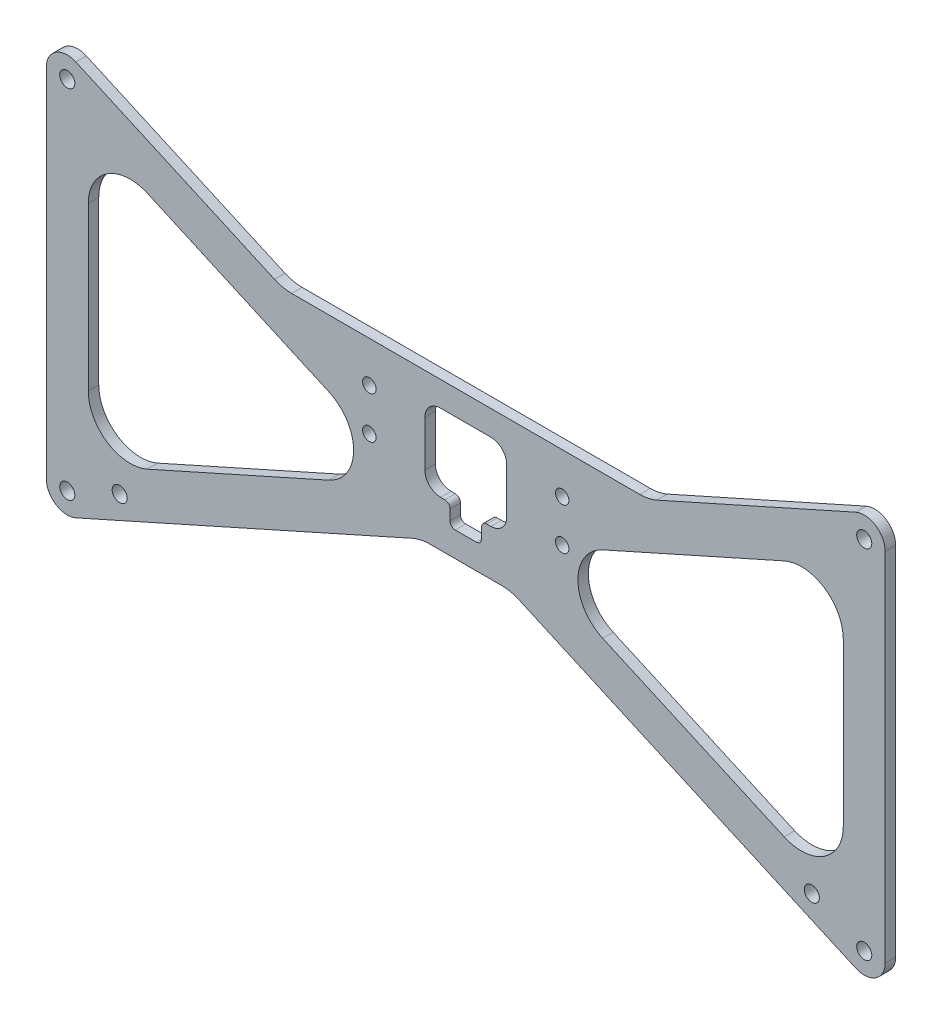
from build123d import *

# Parameters (mm, degrees)
BOSS_EXTRUDE1_DEPTH = 3.175
SKETCH2_R           = 2.286
CUT_EXTRUDE1_DEPTH  = 141.634939649
FILLET1_R           = 12.7
CUT_EXTRUDE2_DEPTH  = 141.634939649
FILLET2_R           = 1.5875
FILLET3_R           = 4.7625
SKETCH4_R           = 2.032
CUT_EXTRUDE3_DEPTH  = 141.634939649


with BuildPart() as part:
    # Sketch1 → Boss-Extrude1 (new body)
    with BuildSketch(Plane.XY):
        with BuildLine():
            Line((-118.056875519, -59.7713959), (-13.632338155, -13.0551555))
            Line((-13.632338155, -13.0551555), (13.632338155, -13.0551555))
            Line((13.632338155, -13.0551555), (118.056875519, -59.7713959))
            ThreePointArc((118.056875519, -59.7713959), (124.103705224, -59.303641499), (127, -53.975))
            Line((127, -53.975), (127, 53.975))
            ThreePointArc((127, 53.975), (124.103705224, 59.303641499), (118.056875519, 59.7713959))
            Line((118.056875519, 59.7713959), (55.420814096, 31.75))
            Line((55.420814096, 31.75), (-55.420814096, 31.75))
            Line((-55.420814096, 31.75), (-118.056875519, 59.7713959))
            ThreePointArc((-118.056875519, 59.7713959), (-124.103705224, 59.303641499), (-127, 53.975))
            Line((-127, 53.975), (-127, -53.975))
            ThreePointArc((-127, -53.975), (-124.103705224, -59.303641499), (-118.056875519, -59.7713959))
        make_face()
        Polygon((-114.3, -44.177732622), (-15.549774139, 0), (-114.3, 44.177732622), align=None, mode=Mode.SUBTRACT)
        Polygon((15.549774139, 0), (114.3, 44.177732622), (114.3, -44.177732622), align=None, mode=Mode.SUBTRACT)
    extrude(amount=BOSS_EXTRUDE1_DEPTH)

    # Sketch2 → Cut-Extrude1 (cut, through all)
    with BuildSketch(Plane.XY.offset(3.175)):
        with Locations((-120.65, 53.975)):
            Circle(SKETCH2_R)
        with Locations((-120.65, -53.975)):
            Circle(SKETCH2_R)
        with Locations((120.65, -53.975)):
            Circle(SKETCH2_R)
        with Locations((120.65, 53.975)):
            Circle(SKETCH2_R)
        with Locations((104.775, -46.873026316)):
            Circle(SKETCH2_R)
        with Locations((-104.775, -46.873026316)):
            Circle(SKETCH2_R)
    extrude(amount=-CUT_EXTRUDE1_DEPTH, mode=Mode.SUBTRACT)

    # Fillet1
    fillet1_edges = [part.edges().sort_by_distance(p)[0] for p in [
        (114.3, -44.177732622, 1.5875),
        (114.3, 44.177732622, 1.5875),
        (15.549774139, 0, 1.5875),
        (-114.3, -44.177732622, 1.5875),
        (-15.549774139, 0, 1.5875),
        (-114.3, 44.177732622, 1.5875),
        (-55.420814096, 31.75, 1.5875),
        (55.420814096, 31.75, 1.5875),
        (13.632338155, -13.0551555, 1.5875),
        (-13.632338155, -13.0551555, 1.5875),
    ]]
    fillet(fillet1_edges, radius=FILLET1_R)

    # Sketch3 → Cut-Extrude2 (cut, through all)
    with BuildSketch(Plane.XY.offset(3.175)):
        Polygon((-12.3825, 24.209375), (12.3825, 24.209375), (12.3825, 0.8334375), (4.7625, 0.8334375), (4.7625, -5.5165625), (-4.7625, -5.5165625), (-4.7625, 0.8334375), (-12.3825, 0.8334375), align=None)
    extrude(amount=-CUT_EXTRUDE2_DEPTH, mode=Mode.SUBTRACT)

    # Fillet2
    fillet2_edges = [part.edges().sort_by_distance(p)[0] for p in [
        (4.7625, -5.5165625, 1.5875),
        (-4.7625, -5.5165625, 1.5875),
        (4.7625, 0.8334375, 1.5875),
        (-4.7625, 0.8334375, 1.5875),
    ]]
    fillet(fillet2_edges, radius=FILLET2_R)

    # Fillet3
    fillet3_edges = [part.edges().sort_by_distance(p)[0] for p in [
        (12.3825, 0.8334375, 1.5875),
        (12.3825, 24.209375, 1.5875),
        (-12.3825, 0.8334375, 1.5875),
        (-12.3825, 24.209375, 1.5875),
    ]]
    fillet(fillet3_edges, radius=FILLET3_R)

    # Sketch4 → Cut-Extrude3 (cut, through all)
    with BuildSketch(Plane(origin=(0, 0, 0), x_dir=(-1, 0, 0), z_dir=(0, 0, -1))):
        with Locations((29.191103812, 19.406990631)):
            Circle(SKETCH4_R)
        with Locations((29.191103812, 6.706990631)):
            Circle(SKETCH4_R)
        with Locations((-29.191103812, 6.706990631)):
            Circle(SKETCH4_R)
        with Locations((-29.191103812, 19.406990631)):
            Circle(SKETCH4_R)
    extrude(amount=-CUT_EXTRUDE3_DEPTH, mode=Mode.SUBTRACT)


solid = part.part
